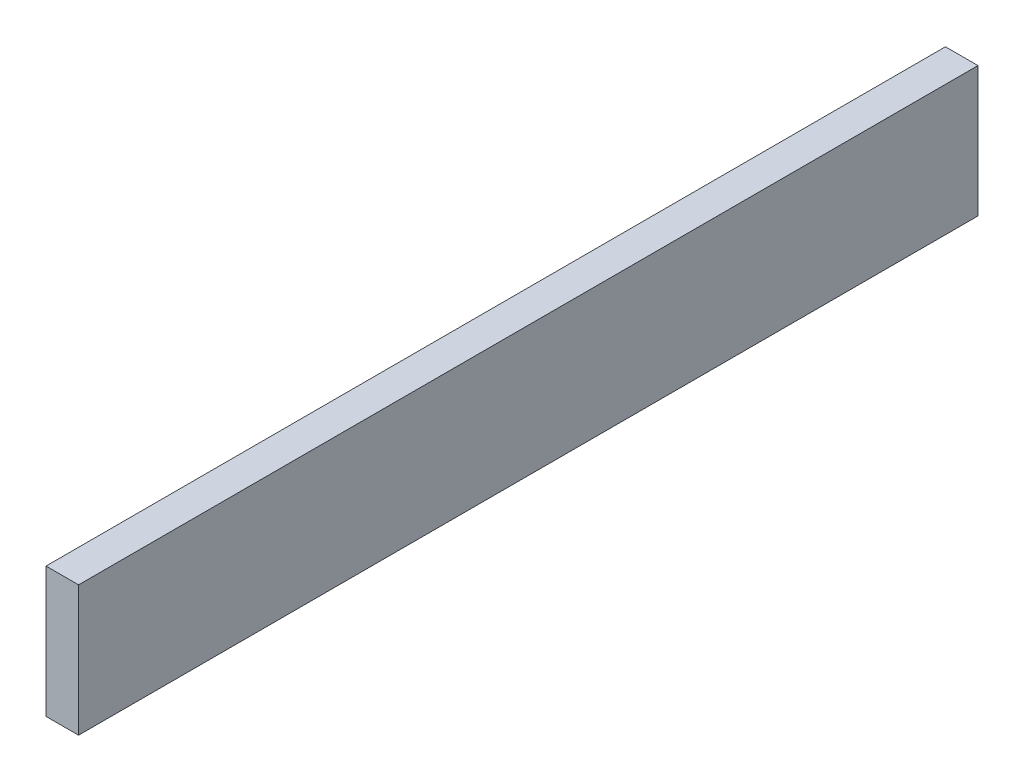
from build123d import *

# Parameters (mm, degrees)
SKETCH1_W           = 350.841564
SKETCH1_H           = 50.8
BOSS_EXTRUDE1_DEPTH = 12.7


with BuildPart() as part:
    # Sketch1 → Boss-Extrude1 (new body)
    with BuildSketch(Plane(origin=(0, 0, 0), x_dir=(0, 0, -1), z_dir=(1, 0, 0))):
        Rectangle(SKETCH1_W, SKETCH1_H)
    extrude(amount=BOSS_EXTRUDE1_DEPTH)


solid = part.part
